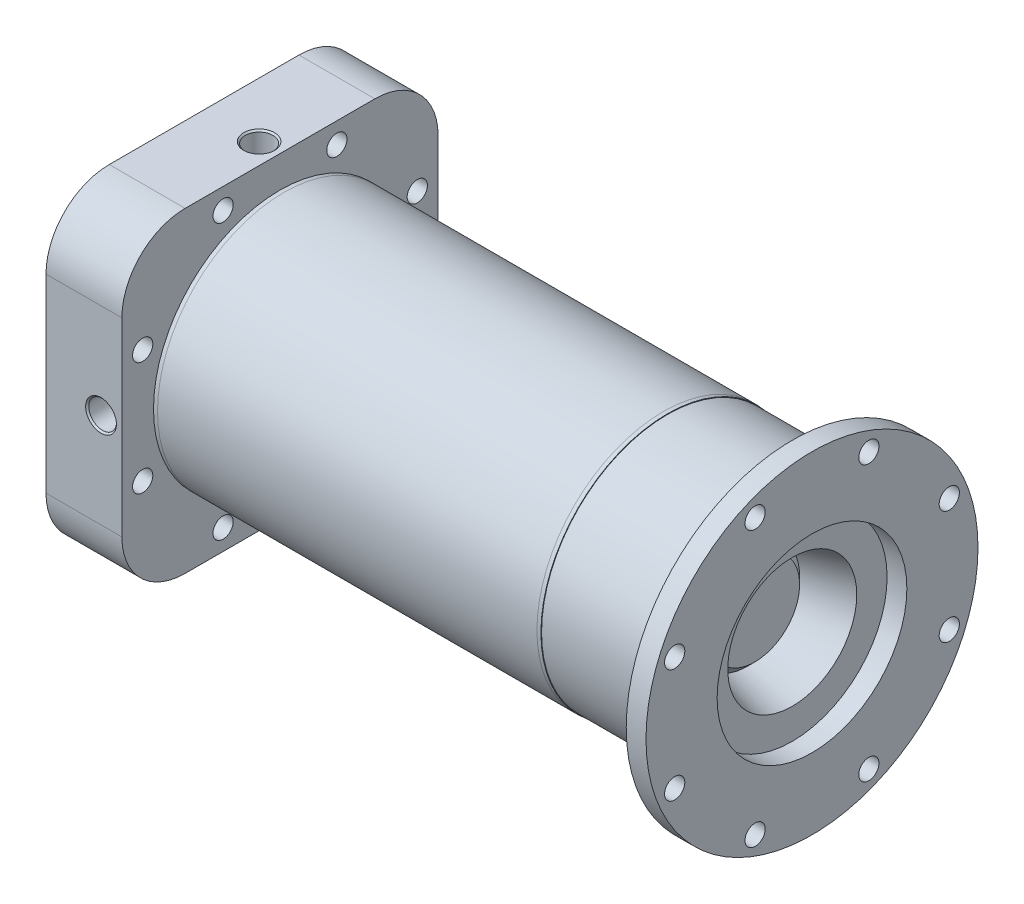
from build123d import *

# Parameters (mm, degrees)
FILLET1_R                = 1.27
CUT_EXTRUDE1_REACH       = 243.296
SKETCH2_R                = 3.81
CIRPATTERN1_COUNT        = 8
SKETCH4_R                = 63.5
BOSS_EXTRUDE1_DEPTH      = 31.75
SKETCH11_W               = 127
SKETCH11_H               = 127
BOSS_EXTRUDE2_DEPTH      = 31.75
SKETCH12_R               = 24.13
CUT_EXTRUDE4_DEPTH       = 16.51
CUT_EXTRUDE5_START       = -39.445315
SKETCH13_R               = 1.905
CUT_EXTRUDE5_DEPTH       = 39.445315
CHAMFER1_SIZE            = 4.572
FILLET2_R                = 0.889
FILLET3_R                = 0.508
CUT_EXTRUDE9_REACH       = 267.18
CUT_EXTRUDE9_END_RADIUS  = 24.13
SKETCH31_R               = 1.5875
SKETCH37_W               = 127
SKETCH37_H               = 127
SKETCH37_R               = 43.7515
CUT_EXTRUDE12_DEPTH      = 1.27
SKETCH32_R               = 69.85
SKETCH32_R_2             = 44.45
BOSS_EXTRUDE3_DEPTH      = 1.6002
SKETCH33_R               = 50.8
SKETCH33_R_2             = 44.45
BOSS_EXTRUDE4_DEPTH      = 152.4
BOSS_EXTRUDE5_START      = 154.0002
SKETCH32_2_R             = 69.85
SKETCH32_2_R_2           = 44.45
BOSS_EXTRUDE5_DEPTH      = 1.6002
FILLET4_R                = 0.254
FILLET5_R                = 1.27
FILLET6_R                = 25.4
CUT_EXTRUDE11_DEPTH      = 227.78903483
CUT_EXTRUDE11_DEPTH_BACK = 1.6002
SKETCH36_R               = 69.85
SKETCH36_R_2             = 50.8
SKETCH39_R               = 66.675
SKETCH39_R_2             = 38.1
BOSS_EXTRUDE6_DEPTH      = 7.9375
SKETCH40_R               = 4.064
CUT_EXTRUDE13_DEPTH      = 255.34917533
CIRPATTERN3_COUNT        = 8
FILLET7_R                = 2.54


# Read off the part's stored shape, not the designer's step: 7/16 (0.4375) Diameter Hole1, 1/4-28 Tapped Hole1
with BuildPart() as part:
    # Chamber Revolve → Revolve1 (revolve)
    with BuildSketch(Plane.XY, mode=Mode.PRIVATE) as revolve1_sk:
        with BuildLine():
            Line((223.962313951, 63.5), (223.962313951, 25.908))
            Line((223.962313951, 25.908), (191.916500941, 17.321350283))
            ThreePointArc((191.916500941, 17.321350283), (190.601700192, 17.321350283), (189.463049342, 17.978750658))
            Line((189.463049342, 17.978750658), (173.5582, 33.8836))
            Line((173.5582, 33.8836), (0, 33.8836))
            Line((0, 33.8836), (0, 42.5196))
            Line((0, 42.5196), (3.8608, 42.5196))
            Line((3.8608, 42.5196), (3.8608, 48.5902))
            Line((3.8608, 48.5902), (0, 48.5902))
            Line((0, 48.5902), (0, 63.5))
            Line((0, 63.5), (10.16, 63.5))
            Line((10.16, 63.5), (10.16, 47.5996))
            Line((10.16, 47.5996), (24.13, 47.5996))
            Line((24.13, 47.5996), (24.13, 63.5))
            Line((24.13, 63.5), (223.962313951, 63.5))
        make_face()
    revolve(revolve1_sk.sketch.rotate(Axis((0, 0, 0), (1, 0, 0)), 90), axis=Axis((0, 0, 0), (1, 0, 0)))

    # Fillet1
    fillet1_edges = [part.edges().sort_by_distance(p)[0] for p in [
        (24.13, 0, -47.5996),
        (10.16, 0, -47.5996),
    ]]
    fillet(fillet1_edges, radius=FILLET1_R)

    # Sketch2 → Cut-Extrude1 (cut, up to next)
    with BuildSketch(Plane.ZY, mode=Mode.PRIVATE) as cut_extrude1_sk1:
        with Locations((-21.773156568, 52.565049882)):
            Circle(SKETCH2_R)
    cut_extrude1_tool1 = extrude(cut_extrude1_sk1.sketch, amount=-CUT_EXTRUDE1_REACH, mode=Mode.PRIVATE) & part.part
    cut_extrude1 = cut_extrude1_tool1.solids().sort_by_distance((0, 52.56505, -21.773157))[0]
    add(cut_extrude1, mode=Mode.SUBTRACT)

    # CirPattern1: Cut-Extrude1 ×8 about axis
    cirpattern1_axis = Axis((0, 0, 0), (1, 0, 0))
    for i in range(1, CIRPATTERN1_COUNT):
        add(cut_extrude1.rotate(cirpattern1_axis, i * 360 / CIRPATTERN1_COUNT), mode=Mode.SUBTRACT)

    # Fillet2
    fillet2_edges = [part.edges().sort_by_distance(p)[0] for p in [
        (3.8608, 0, -42.5196),
        (3.8608, 0, -48.5902),
    ]]
    fillet(fillet2_edges, radius=FILLET2_R)


with BuildPart() as body_2:
    # Sketch4 → Boss-Extrude1 (new body)
    with BuildSketch(Plane.ZY):
        Circle(SKETCH4_R)
    extrude(amount=BOSS_EXTRUDE1_DEPTH)

    # Sketch11 → Boss-Extrude2 (add)
    with BuildSketch(Plane.ZY.offset(31.75)):
        Rectangle(SKETCH11_W, SKETCH11_H)
    extrude(amount=-BOSS_EXTRUDE2_DEPTH)

    # Sketch12 → Cut-Extrude4 (cut)
    with BuildSketch(Plane(origin=(0, 0, 0), x_dir=(0, 0, -1), z_dir=(1, 0, 0))):
        Circle(SKETCH12_R)
    extrude(amount=-CUT_EXTRUDE4_DEPTH, mode=Mode.SUBTRACT)

    # Sketch13 → Cut-Extrude5 (cut)
    with BuildSketch(Plane.XY.offset(63.5).offset(CUT_EXTRUDE5_START)):
        with Locations((-9.652, 0)):
            Circle(SKETCH13_R)
    cut_extrude5 = extrude(amount=CUT_EXTRUDE5_DEPTH, mode=Mode.SUBTRACT)

    # Chamfer1
    chamfer1_edges = [body_2.edges().sort_by_distance(p)[0] for p in [
        (0, 0, 24.13),
    ]]
    chamfer(chamfer1_edges, length=CHAMFER1_SIZE)

    # 7/16 (0.4375) Diameter Hole1 outline → 7/16 (0.4375) Diameter Hole1 (revolve, cut)
    with BuildSketch(Plane(origin=(-9.652, 0, 0), x_dir=(1, 0, 0), z_dir=(0, -1, 0))):
        Polygon((1.905, 63.5), (1.905, 42.256107665), (5.55625, 44.45), (5.55625, 62.865), (6.19125, 63.5), align=None)
    f_7_16_0_4375_diameter_hole1 = revolve(axis=Axis((-9.652, 0, 0), (0, 0, 1)), mode=Mode.SUBTRACT)

    # Mirror1: Cut-Extrude5, 7/16 (0.4375) Diameter Hole1 across plane
    add(cut_extrude5.mirror(Plane.XY), mode=Mode.SUBTRACT)
    add(f_7_16_0_4375_diameter_hole1.mirror(Plane.XY), mode=Mode.SUBTRACT)

    # 1/4-28 Tapped Hole1 outline → 1/4-28 Tapped Hole1 (revolve, cut)
    with BuildSketch(Plane(origin=(0, -33.02, 0), x_dir=(0, 1, 0), z_dir=(0, 0, -1))):
        Polygon((2.7051, -17.526), (0, -15.900611939), (0, -31.75), (3.81, -31.75), (2.7051, -30.6451), align=None)
    f_1_4_28_tapped_hole1 = revolve(axis=Axis((0, -33.02, 0), (1, 0, 0)), mode=Mode.SUBTRACT)

    # Mirror2: 1/4-28 Tapped Hole1 across plane
    add(f_1_4_28_tapped_hole1.mirror(Plane.ZX), mode=Mode.SUBTRACT)

    # Sketch24 → Cut-Revolve1 (revolve, cut)
    with BuildSketch(Plane(origin=(0, 0, 0), x_dir=(1, 0, 0), z_dir=(0, 1, 0))):
        with BuildLine():
            Line((-31.75, 7.1374), (-30.958106371, 5.7658))
            Line((-30.958106371, 5.7658), (-29.845, 5.7658))
            ThreePointArc((-29.845, 5.7658), (-29.650596816, 5.727130803), (-29.485789755, 5.617010245))
            Line((-29.485789755, 5.617010245), (-28.73287951, 4.8641))
            Line((-28.73287951, 4.8641), (-16.51, 4.8641))
            Line((-16.51, 4.8641), (-16.51, 0))
            Line((-16.51, 0), (-31.75, 0))
            Line((-31.75, 0), (-31.75, 7.1374))
        make_face()
    revolve(axis=Axis((223.962313951, 0, 0), (-1, 0, 0)), mode=Mode.SUBTRACT)

    # Fillet3
    fillet3_edges = [body_2.edges().sort_by_distance(p)[0] for p in [
        (-30.958106371, 0, 5.7658),
    ]]
    fillet(fillet3_edges, radius=FILLET3_R)

    # Sketch30 → 7/16 (0.4375) Diameter Hole2 (revolve, cut)
    with BuildSketch(Plane(origin=(-9.652, -63.5, 0), x_dir=(0, 0, -1), z_dir=(1, 0, 0))):
        Polygon((0, 0), (0, 22.388531814), (5.55625, 19.05), (5.55625, 0.635), (6.19125, 0), align=None)
    f_7_16_0_4375_diameter_hole2 = revolve(axis=Axis((-9.652, -69.85, 0), (0, 1, 0)), mode=Mode.SUBTRACT)

    # Cut-Extrude9: up to this cylinder (the profile starts outside it)
    cut_extrude9_end = Plane(origin=(-9.652, 0, 0), z_dir=(1, 0, 0)) * Cylinder(CUT_EXTRUDE9_END_RADIUS, 583.62, mode=Mode.PRIVATE)
    # Sketch31 → Cut-Extrude9 (cut, up to the surface)
    with BuildSketch(Plane.XZ.offset(63.5), mode=Mode.PRIVATE) as cut_extrude9_sk1:
        with Locations(Location((-9.652, 0, 0), (0, 0, 270))):
            Circle(SKETCH31_R)
    cut_extrude9_tool1 = extrude(cut_extrude9_sk1.sketch, amount=-CUT_EXTRUDE9_REACH, mode=Mode.PRIVATE) - cut_extrude9_end
    cut_extrude9 = cut_extrude9_tool1.solids().sort_by_distance((-9.652, -63.5, 0))[0]
    add(cut_extrude9, mode=Mode.SUBTRACT)

    # Mirror3: 7/16 (0.4375) Diameter Hole2, Cut-Extrude9 across plane
    add(f_7_16_0_4375_diameter_hole2.mirror(Plane.ZX), mode=Mode.SUBTRACT)
    add(cut_extrude9.mirror(Plane.ZX), mode=Mode.SUBTRACT)

    # Sketch37 → Cut-Extrude12 (cut)
    with BuildSketch(Plane(origin=(0, 0, 0), x_dir=(0, 0, -1), z_dir=(1, 0, 0))):
        Rectangle(SKETCH37_W, SKETCH37_H)
        Circle(SKETCH37_R, mode=Mode.SUBTRACT)
    extrude(amount=-CUT_EXTRUDE12_DEPTH, mode=Mode.SUBTRACT)

    # Fillet6
    fillet6_edges = [body_2.edges().sort_by_distance(p)[0] for p in [
        (-16.51, 63.5, 63.5),
        (-16.51, -63.5, 63.5),
        (-16.51, -63.5, -63.5),
        (-16.51, 63.5, -63.5),
    ]]
    fillet(fillet6_edges, radius=FILLET6_R)


with BuildPart() as body_3:
    # Sketch21 → Revolve2 (revolve)
    with BuildSketch(Plane(origin=(0, 0, 0), x_dir=(1, 0, 0), z_dir=(0, 1, 0))):
        Polygon((0, 33.8836), (173.5582, 33.8836), (189.463049342, 17.978750658), (189.463049342, 0), (0, 0), align=None)
    revolve(axis=Axis((189.463049342, 0, 0), (1, 0, 0)))


with BuildPart() as body_3_2:
    # Sketch32 → Boss-Extrude3 (new body)
    with BuildSketch(Plane(origin=(-1.27, 0, 0), x_dir=(0, 0, -1), z_dir=(1, 0, 0))):
        Circle(SKETCH32_R)
        Circle(SKETCH32_R_2, mode=Mode.SUBTRACT)
    extrude(amount=BOSS_EXTRUDE3_DEPTH)


with BuildPart() as body_4:
    # Sketch33 → Boss-Extrude4 (new body)
    with BuildSketch(Plane(origin=(0.3302, 0, 0), x_dir=(0, 0, -1), z_dir=(1, 0, 0))):
        with Locations(Location((0, 0, 0), (0, 0, 180))):
            Circle(SKETCH33_R)
        with Locations(Location((0, 0, 0), (0, 0, 180))):
            Circle(SKETCH33_R_2, mode=Mode.SUBTRACT)
    extrude(amount=BOSS_EXTRUDE4_DEPTH)


with BuildPart() as body_5:
    # Sketch32<2> → Boss-Extrude5 (new body)
    with BuildSketch(Plane(origin=(-1.27, 0, 0), x_dir=(0, 0, -1), z_dir=(1, 0, 0)).offset(BOSS_EXTRUDE5_START)):
        Circle(SKETCH32_2_R)
        Circle(SKETCH32_2_R_2, mode=Mode.SUBTRACT)
    extrude(amount=BOSS_EXTRUDE5_DEPTH)


with BuildPart() as body_6:
    # Sketch34 → Revolve3 (revolve)
    with BuildSketch(Plane.XY, mode=Mode.PRIVATE) as revolve3_sk:
        Polygon((154.3304, 50.546), (154.3304, 43.815), (151.7904, 43.815), (151.7904, 40.767), (154.3304, 40.767), (171.012984639, 16.9418), (204.47529859, 25.908), (204.47529859, 50.546), align=None)
    revolve(revolve3_sk.sketch.rotate(Axis((152.7302, 0, 0), (-1, 0, 0)), 90), axis=Axis((152.7302, 0, 0), (-1, 0, 0)))

    # Fillet4
    fillet4_edges = [body_6.edges().sort_by_distance(p)[0] for p in [
        (154.3304, 0, 43.815),
    ]]
    fillet(fillet4_edges, radius=FILLET4_R)

    # Fillet5
    fillet5_edges = [body_6.edges().sort_by_distance(p)[0] for p in [
        (171.012984639, 0, 16.9418),
    ]]
    fillet(fillet5_edges, radius=FILLET5_R)

    # Fillet7
    fillet7_edges = [body_6.edges().sort_by_distance(p)[0] for p in [
        (154.3304, 0, 40.767),
    ]]
    fillet(fillet7_edges, radius=FILLET7_R)


with BuildPart() as cut_extrude11_tool:
    # Sketch36 → Cut-Extrude11 (new, two sides: drawn at the far end of the back side and taken through both)
    with BuildSketch(Plane(origin=(0.3302, 0, 0), x_dir=(0, 0, -1), z_dir=(1, 0, 0)).offset(-CUT_EXTRUDE11_DEPTH_BACK)):
        Circle(SKETCH36_R)
        Circle(SKETCH36_R_2, mode=Mode.SUBTRACT)
    extrude(amount=CUT_EXTRUDE11_DEPTH + CUT_EXTRUDE11_DEPTH_BACK)


with BuildPart() as body_3_2_1:
    add(body_3_2.part)

    # Cut-Extrude11: cut by cut_extrude11_tool
    add(cut_extrude11_tool.part, mode=Mode.SUBTRACT)


with BuildPart() as body_5_1:
    add(body_5.part)

    # Cut-Extrude11: cut by cut_extrude11_tool
    add(cut_extrude11_tool.part, mode=Mode.SUBTRACT)


with BuildPart() as body_7:
    # Sketch39 → Boss-Extrude6 (new body)
    with BuildSketch(Plane(origin=(204.47529859, 0, 0), x_dir=(0, 0, -1), z_dir=(1, 0, 0))):
        Circle(SKETCH39_R)
        Circle(SKETCH39_R_2, mode=Mode.SUBTRACT)
    extrude(amount=BOSS_EXTRUDE6_DEPTH)


with BuildPart() as cut_extrude13_tool:
    # Sketch40 → Cut-Extrude13 (new, symmetric)
    with BuildSketch(Plane.ZY.offset(-204.47529859)):
        with Locations(Location((-22.842374078, 55.146369296, 0), (0, 0, 180))):
            Circle(SKETCH40_R)
    cut_extrude13 = extrude(amount=CUT_EXTRUDE13_DEPTH, both=True)


with BuildPart() as body_2_1:
    add(body_2.part)

    # Cut-Extrude13: cut by cut_extrude13_tool
    add(cut_extrude13_tool.part, mode=Mode.SUBTRACT)


with BuildPart() as body_7_1:
    add(body_7.part)

    # Cut-Extrude13: cut by cut_extrude13_tool
    add(cut_extrude13_tool.part, mode=Mode.SUBTRACT)


with BuildPart() as cirpattern3_tool:
    # CirPattern3: Cut-Extrude13 ×8 about axis
    cirpattern3_axis = Axis((0, 0, 0), (1, 0, 0))
    for i in range(1, CIRPATTERN3_COUNT):
        add(cut_extrude13.rotate(cirpattern3_axis, i * 360 / CIRPATTERN3_COUNT))


with BuildPart() as body_2_2:
    add(body_2_1.part)

    # CirPattern3: cut by cirpattern3_tool
    add(cirpattern3_tool.part, mode=Mode.SUBTRACT)


with BuildPart() as body_7_2:
    add(body_7_1.part)

    # CirPattern3: cut by cirpattern3_tool
    add(cirpattern3_tool.part, mode=Mode.SUBTRACT)


solid = Compound([body_3.part, body_4.part, body_6.part, body_3_2_1.part, body_5_1.part, body_2_2.part, body_7_2.part])
